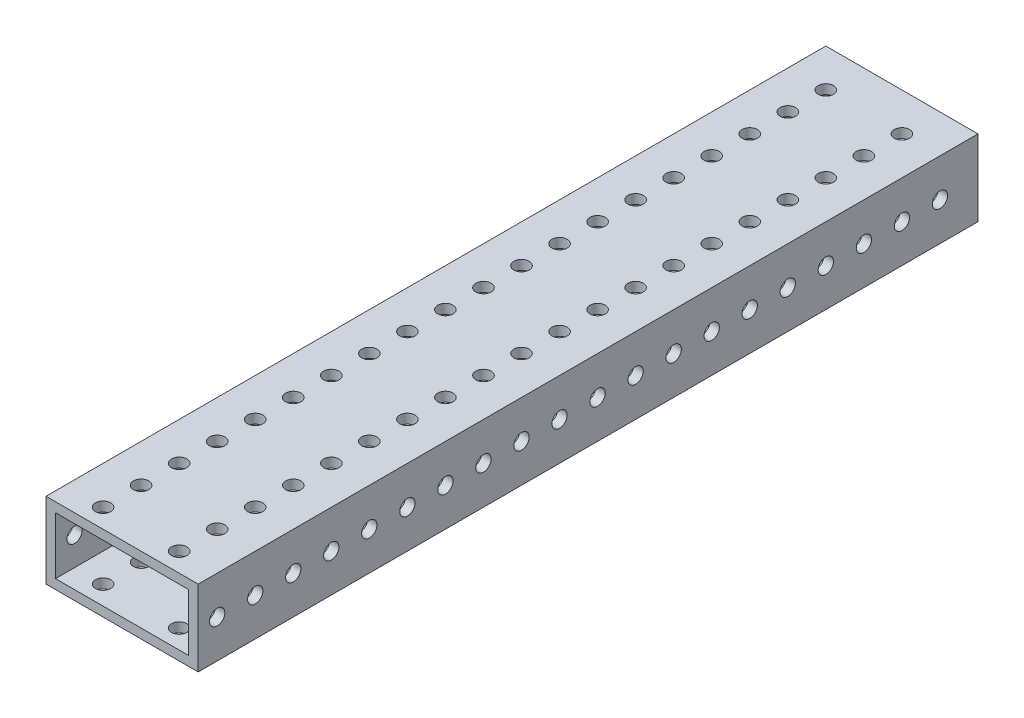
from build123d import *

# Parameters (mm, degrees)
SKETCH1_W           = 50.8
SKETCH1_H           = 25.4
SKETCH1_W_2         = 44.45
SKETCH1_H_2         = 19.05
BOSS_EXTRUDE1_DEPTH = 184.15
SKETCH6_R           = 2.5527
CUT_EXTRUDE5_DEPTH  = 192.450130582
SKETCH5_W           = 63.5
SKETCH5_H           = 25.4
CUT_EXTRUDE6_DEPTH  = 192.450130582
SKETCH2_R           = 2.5527
CUT_EXTRUDE1_DEPTH  = 188.620741124
SKETCH7_W           = 44.45
SKETCH7_H           = 25.4
CUT_EXTRUDE7_DEPTH  = 192.450130582


with BuildPart() as part:
    # Sketch1 → Boss-Extrude1 (new, symmetric)
    with BuildSketch(Plane.XY):
        Rectangle(SKETCH1_W, SKETCH1_H)
        Rectangle(SKETCH1_W_2, SKETCH1_H_2, mode=Mode.SUBTRACT)
    extrude(amount=BOSS_EXTRUDE1_DEPTH, both=True)

    # Sketch6 → Cut-Extrude5 (cut, through all)
    with BuildSketch(Plane(origin=(25.4, 0, 0), x_dir=(0, 0, -1), z_dir=(1, 0, 0))):
        with Locations((-177.8, 0)):
            Circle(SKETCH6_R)
        with Locations((-165.1, 0)):
            Circle(SKETCH6_R)
        with Locations((-152.4, 0)):
            Circle(SKETCH6_R)
        with Locations((-139.7, 0)):
            Circle(SKETCH6_R)
        with Locations((-127, 0)):
            Circle(SKETCH6_R)
        with Locations((-114.3, 0)):
            Circle(SKETCH6_R)
        with Locations((-101.6, 0)):
            Circle(SKETCH6_R)
        with Locations((-88.9, 0)):
            Circle(SKETCH6_R)
        with Locations((-76.2, 0)):
            Circle(SKETCH6_R)
        with Locations((-63.5, 0)):
            Circle(SKETCH6_R)
        with Locations((-50.8, 0)):
            Circle(SKETCH6_R)
        with Locations((-38.1, 0)):
            Circle(SKETCH6_R)
        with Locations((-25.4, 0)):
            Circle(SKETCH6_R)
        with Locations((-12.7, 0)):
            Circle(SKETCH6_R)
        Circle(SKETCH6_R)
        with Locations((12.7, 0)):
            Circle(SKETCH6_R)
        with Locations((25.4, 0)):
            Circle(SKETCH6_R)
        with Locations((38.1, 0)):
            Circle(SKETCH6_R)
        with Locations((50.8, 0)):
            Circle(SKETCH6_R)
        with Locations((63.5, 0)):
            Circle(SKETCH6_R)
        with Locations((88.9, 0)):
            Circle(SKETCH6_R)
        with Locations((101.6, 0)):
            Circle(SKETCH6_R)
    extrude(amount=-CUT_EXTRUDE5_DEPTH, mode=Mode.SUBTRACT)

    # Sketch5 → Cut-Extrude6 (cut, through all)
    with BuildSketch(Plane.ZY.offset(25.4)):
        with Locations((-152.4, 0)):
            Rectangle(SKETCH5_W, SKETCH5_H)
    extrude(amount=-CUT_EXTRUDE6_DEPTH, mode=Mode.SUBTRACT)

    # Sketch2 → Cut-Extrude1 (cut, through all)
    with BuildSketch(Plane(origin=(0, 12.7, 0), x_dir=(1, 0, 0), z_dir=(0, 1, 0))):
        with Locations((12.7, -177.8)):
            Circle(SKETCH2_R)
        with Locations((-12.7, -177.8)):
            Circle(SKETCH2_R)
        with Locations((-12.7, -165.1)):
            Circle(SKETCH2_R)
        with Locations((-12.7, -152.4)):
            Circle(SKETCH2_R)
        with Locations((-12.7, -139.7)):
            Circle(SKETCH2_R)
        with Locations((-12.7, -127)):
            Circle(SKETCH2_R)
        with Locations((-12.7, -114.3)):
            Circle(SKETCH2_R)
        with Locations((-12.7, -101.6)):
            Circle(SKETCH2_R)
        with Locations((-12.7, -88.9)):
            Circle(SKETCH2_R)
        with Locations((-12.7, -76.2)):
            Circle(SKETCH2_R)
        with Locations((-12.7, -63.5)):
            Circle(SKETCH2_R)
        with Locations((-12.7, -50.8)):
            Circle(SKETCH2_R)
        with Locations((-12.7, -38.1)):
            Circle(SKETCH2_R)
        with Locations((-12.7, -25.4)):
            Circle(SKETCH2_R)
        with Locations((-12.7, -12.7)):
            Circle(SKETCH2_R)
        with Locations((-12.7, 0)):
            Circle(SKETCH2_R)
        with Locations((-12.7, 12.7)):
            Circle(SKETCH2_R)
        with Locations((-12.7, 25.4)):
            Circle(SKETCH2_R)
        with Locations((-12.7, 38.1)):
            Circle(SKETCH2_R)
        with Locations((-12.7, 50.8)):
            Circle(SKETCH2_R)
        with Locations((-12.7, 63.5)):
            Circle(SKETCH2_R)
        with Locations((-12.7, 88.9)):
            Circle(SKETCH2_R)
        with Locations((-12.7, 101.6)):
            Circle(SKETCH2_R)
        with Locations((-12.7, 139.7)):
            Circle(SKETCH2_R)
        with Locations((-12.7, 152.4)):
            Circle(SKETCH2_R)
        with Locations((-12.7, 165.1)):
            Circle(SKETCH2_R)
        with Locations((-12.7, 190.5)):
            Circle(SKETCH2_R)
        with Locations((-12.7, 203.2)):
            Circle(SKETCH2_R)
        with Locations((-12.7, 215.9)):
            Circle(SKETCH2_R)
        with Locations((-12.7, 228.6)):
            Circle(SKETCH2_R)
        with Locations((-12.7, 241.3)):
            Circle(SKETCH2_R)
        with Locations((-12.7, 254)):
            Circle(SKETCH2_R)
        with Locations((-12.7, 266.7)):
            Circle(SKETCH2_R)
        with Locations((-12.7, 279.4)):
            Circle(SKETCH2_R)
        with Locations((-12.7, 292.1)):
            Circle(SKETCH2_R)
        with Locations((-12.7, 304.8)):
            Circle(SKETCH2_R)
        with Locations((-12.7, 317.5)):
            Circle(SKETCH2_R)
        with Locations((-12.7, 330.2)):
            Circle(SKETCH2_R)
        with Locations((-12.7, 342.9)):
            Circle(SKETCH2_R)
        with Locations((-12.7, 355.6)):
            Circle(SKETCH2_R)
        with Locations((-12.7, 368.3)):
            Circle(SKETCH2_R)
        with Locations((-12.7, 381)):
            Circle(SKETCH2_R)
        with Locations((-12.7, 393.7)):
            Circle(SKETCH2_R)
        with Locations((-12.7, 406.4)):
            Circle(SKETCH2_R)
        with Locations((12.7, -165.1)):
            Circle(SKETCH2_R)
        with Locations((12.7, -152.4)):
            Circle(SKETCH2_R)
        with Locations((12.7, -139.7)):
            Circle(SKETCH2_R)
        with Locations((12.7, -127)):
            Circle(SKETCH2_R)
        with Locations((12.7, -114.3)):
            Circle(SKETCH2_R)
        with Locations((12.7, -101.6)):
            Circle(SKETCH2_R)
        with Locations((12.7, -88.9)):
            Circle(SKETCH2_R)
        with Locations((12.7, -76.2)):
            Circle(SKETCH2_R)
        with Locations((12.7, -63.5)):
            Circle(SKETCH2_R)
        with Locations((12.7, -50.8)):
            Circle(SKETCH2_R)
        with Locations((12.7, -38.1)):
            Circle(SKETCH2_R)
        with Locations((12.7, -25.4)):
            Circle(SKETCH2_R)
        with Locations((12.7, -12.7)):
            Circle(SKETCH2_R)
        with Locations((12.7, 0)):
            Circle(SKETCH2_R)
        with Locations((12.7, 12.7)):
            Circle(SKETCH2_R)
        with Locations((12.7, 25.4)):
            Circle(SKETCH2_R)
        with Locations((12.7, 38.1)):
            Circle(SKETCH2_R)
        with Locations((12.7, 50.8)):
            Circle(SKETCH2_R)
        with Locations((12.7, 63.5)):
            Circle(SKETCH2_R)
        with Locations((12.7, 88.9)):
            Circle(SKETCH2_R)
        with Locations((12.7, 101.6)):
            Circle(SKETCH2_R)
        with Locations((12.7, 139.7)):
            Circle(SKETCH2_R)
        with Locations((12.7, 152.4)):
            Circle(SKETCH2_R)
        with Locations((12.7, 165.1)):
            Circle(SKETCH2_R)
        with Locations((12.7, 190.5)):
            Circle(SKETCH2_R)
        with Locations((12.7, 203.2)):
            Circle(SKETCH2_R)
        with Locations((12.7, 215.9)):
            Circle(SKETCH2_R)
        with Locations((12.7, 228.6)):
            Circle(SKETCH2_R)
        with Locations((12.7, 241.3)):
            Circle(SKETCH2_R)
        with Locations((12.7, 254)):
            Circle(SKETCH2_R)
        with Locations((12.7, 266.7)):
            Circle(SKETCH2_R)
        with Locations((12.7, 279.4)):
            Circle(SKETCH2_R)
        with Locations((12.7, 292.1)):
            Circle(SKETCH2_R)
        with Locations((12.7, 304.8)):
            Circle(SKETCH2_R)
        with Locations((12.7, 317.5)):
            Circle(SKETCH2_R)
        with Locations((12.7, 330.2)):
            Circle(SKETCH2_R)
        with Locations((12.7, 342.9)):
            Circle(SKETCH2_R)
        with Locations((12.7, 355.6)):
            Circle(SKETCH2_R)
        with Locations((12.7, 368.3)):
            Circle(SKETCH2_R)
        with Locations((12.7, 381)):
            Circle(SKETCH2_R)
        with Locations((12.7, 393.7)):
            Circle(SKETCH2_R)
        with Locations((12.7, 406.4)):
            Circle(SKETCH2_R)
        with Locations((12.7, 419.1)):
            Circle(SKETCH2_R)
        with Locations((12.7, 431.8)):
            Circle(SKETCH2_R)
        with Locations((12.7, 444.5)):
            Circle(SKETCH2_R)
    extrude(amount=-CUT_EXTRUDE1_DEPTH, mode=Mode.SUBTRACT)

    # Sketch7 → Cut-Extrude7 (cut, through all)
    with BuildSketch(Plane.ZY.offset(25.4)):
        with Locations((-98.425, 0)):
            Rectangle(SKETCH7_W, SKETCH7_H)
    extrude(amount=-CUT_EXTRUDE7_DEPTH, mode=Mode.SUBTRACT)


solid = part.part
